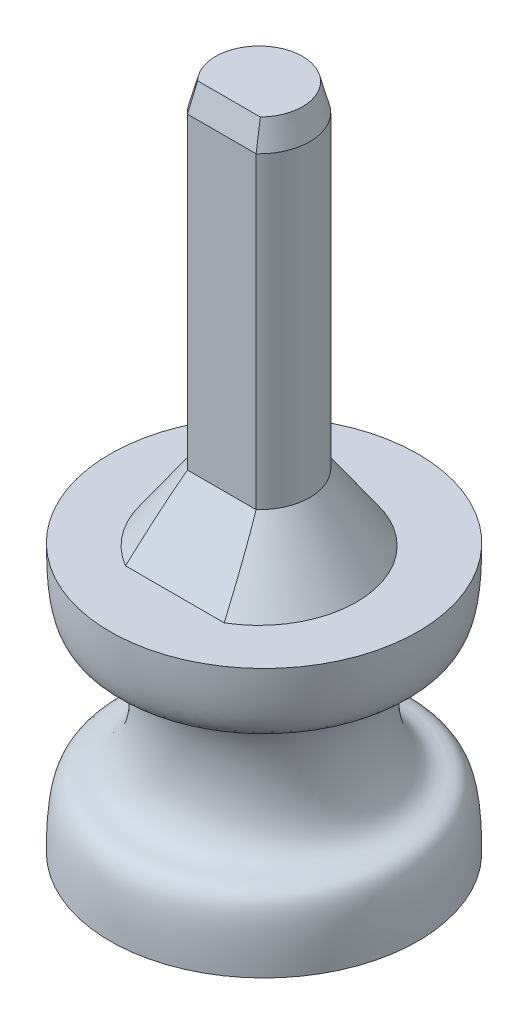
from build123d import *
from OCP.BRepFilletAPI import BRepFilletAPI_MakeChamfer

# Parameters (mm, degrees)
BOSS_EXTRUDE1_DEPTH = 20
CHAMFER1_SIZE       = 1.2
CHAMFER1_SIZE2      = 0.321539031
CHAMFER2_SIZE       = 3
CHAMFER2_SIZE2      = 2.100622615


# Read off the part's stored shape, not the designer's step: Revolve1
with BuildPart() as part:
    # Sketch1 → Boss-Extrude1 (new body)
    with BuildSketch(Plane(origin=(0, 0, 0), x_dir=(1, 0, 0), z_dir=(0, 1, 0))):
        with BuildLine():
            Line((-1.537530488, -1.67), (1.537530488, -1.67))
            ThreePointArc((1.537530488, -1.67), (0, 2.27), (-1.537530488, -1.67))
        make_face()
    extrude(amount=BOSS_EXTRUDE1_DEPTH)

    # Chamfer1: one chamfer whose edges measure the first distance from different faces: ONE call of the kernel's chamfer builder (chamfer() names one face for all edges)
    chamfer1_edges_1 = [part.edges().sort_by_distance(p)[0] for p in [
        (0, 20, -2.27),
    ]]
    chamfer1_side_1 = [part.faces().sort_by_distance(p)[0] for p in [
        (0, 10, -2.27),
    ]]
    chamfer1_edges_2 = [part.edges().sort_by_distance(p)[0] for p in [
        (0, 20, 1.67),
    ]]
    chamfer1_side_2 = [part.faces().sort_by_distance(p)[0] for p in [
        (0, 10, 1.67),
    ]]
    chamfer1 = BRepFilletAPI_MakeChamfer(part.part.solid().wrapped)
    for e in chamfer1_edges_1:
        chamfer1.Add(CHAMFER1_SIZE, CHAMFER1_SIZE2, e.wrapped, chamfer1_side_1[0].wrapped)  # the first distance lies on this face
    for e in chamfer1_edges_2:
        chamfer1.Add(CHAMFER1_SIZE, CHAMFER1_SIZE2, e.wrapped, chamfer1_side_2[0].wrapped)  # the first distance lies on this face
    add(Compound.cast(chamfer1.Shape()), mode=Mode.REPLACE)

    # Revolve1 outline → Revolve1 (revolve)
    with BuildSketch(Plane.XY.offset(-0.223266571)):
        with BuildLine():
            Line((6.893266571, 2), (1.893266571, 2))
            Line((1.893266571, 2), (1.893266571, 0))
            Line((1.893266571, 0), (0, 0))
            Line((0, 0), (0, -10))
            Line((0, -10), (6.893266571, -10))
            add(Edge.make_bspline(
                [(6.893266571, -10), (6.893266571, -0.153248468), (2.676005531, -20.148158745), (2.676005531, 12.148158745), (6.893266571, -7.846751532), (6.893266571, 2)],
                knots=[0.057927251, 0.057927251, 0.057927251, 0.057927251, 0.057927251, 0.057927251, 1.057927251, 1.057927251, 1.057927251, 1.057927251, 1.057927251, 1.057927251], degree=5))
        make_face()
    revolve(axis=Axis((0, 0, -0.223266571), (0, 1, 0)))

    # Chamfer2: one chamfer whose edges measure the first distance from different faces: ONE call of the kernel's chamfer builder (chamfer() names one face for all edges)
    chamfer2_edges_1 = [part.edges().sort_by_distance(p)[0] for p in [
        (0, 2, 1.67),
    ]]
    chamfer2_side_1 = [part.faces().sort_by_distance(p)[0] for p in [
        (0, 10.4, 1.67),
    ]]
    chamfer2_edges_2 = [part.edges().sort_by_distance(p)[0] for p in [
        (0, 2, -2.27),
    ]]
    chamfer2_side_2 = [part.faces().sort_by_distance(p)[0] for p in [
        (0, 10.4, -2.27),
    ]]
    chamfer2 = BRepFilletAPI_MakeChamfer(part.part.solid().wrapped)
    for e in chamfer2_edges_1:
        chamfer2.Add(CHAMFER2_SIZE, CHAMFER2_SIZE2, e.wrapped, chamfer2_side_1[0].wrapped)  # the first distance lies on this face
    for e in chamfer2_edges_2:
        chamfer2.Add(CHAMFER2_SIZE, CHAMFER2_SIZE2, e.wrapped, chamfer2_side_2[0].wrapped)  # the first distance lies on this face
    add(Compound.cast(chamfer2.Shape()), mode=Mode.REPLACE)


solid = part.part
